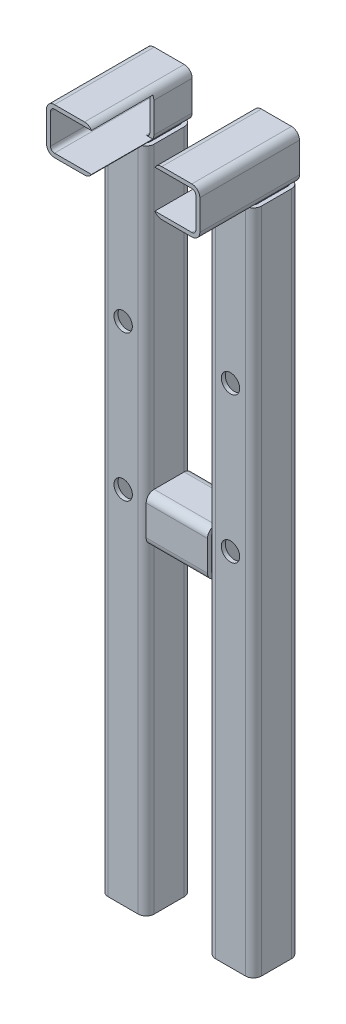
from build123d import *

# Parameters (mm, degrees)
RURA_START                              = -15
RURA_KWADRATOWA_30_X_30_X_2_6_1_DEPTH   = 65
RURA_START_2                            = -225
RURA_KWADRATOWA_30_X_30_X_2_6_1_2_DEPTH = 435
RURA_START_3                            = -20
RURA_KWADRATOWA_30_X_30_X_2_6_1_3_DEPTH = 40
WYTNIJ_WYCI_GNI_CIE1_START              = -5.2
SZKIC3_W                                = 40
SZKIC3_H                                = 24.8
WYTNIJ_WYCI_GNI_CIE1_DEPTH              = 50.4
SZKIC4_R                                = 6
WYTNIJ_WYCI_GNI_CIE2_DEPTH              = 254.623737059


# Read off the part's stored shape, not the designer's step: Rura kwadratowa 30 X 30 X 2.6(1)
with BuildPart() as part:
    # Rura kwadratowa 30 X 30 X 2.6(1) outline → Rura kwadratowa 30 X 30 X 2.6(1) (new body)
    # profile 1 of 2: a face of its own
    with BuildSketch(Plane.XY.offset(RURA_START)):
        with BuildLine():
            Line((-44.8, 210), (-25.2, 210))
            ThreePointArc((-25.2, 210), (-21.523044738, 211.523044738), (-20, 215.2))
            Line((-20, 215.2), (-20, 234.8))
            ThreePointArc((-20, 234.8), (-21.523044738, 238.476955262), (-25.2, 240))
            Line((-25.2, 240), (-44.8, 240))
            ThreePointArc((-44.8, 240), (-48.476955262, 238.476955262), (-50, 234.8))
            Line((-50, 234.8), (-50, 215.2))
            ThreePointArc((-50, 215.2), (-48.476955262, 211.523044738), (-44.8, 210))
        make_face()
        with BuildLine():
            ThreePointArc((-44.8, 212.6), (-46.638477631, 213.361522369), (-47.4, 215.2))
            Line((-47.4, 215.2), (-47.4, 234.8))
            ThreePointArc((-47.4, 234.8), (-46.638477631, 236.638477631), (-44.8, 237.4))
            Line((-44.8, 237.4), (-25.2, 237.4))
            ThreePointArc((-25.2, 237.4), (-23.361522369, 236.638477631), (-22.6, 234.8))
            Line((-22.6, 234.8), (-22.6, 215.2))
            ThreePointArc((-22.6, 215.2), (-23.361522369, 213.361522369), (-25.2, 212.6))
            Line((-25.2, 212.6), (-44.8, 212.6))
        make_face(mode=Mode.SUBTRACT)
    # profile 2 of 2: a face of its own
    with BuildSketch(Plane.XY.offset(RURA_START)):
        with BuildLine():
            ThreePointArc((50, 234.8), (48.476955262, 238.476955262), (44.8, 240))
            Line((44.8, 240), (25.2, 240))
            ThreePointArc((25.2, 240), (21.523044738, 238.476955262), (20, 234.8))
            Line((20, 234.8), (20, 215.2))
            ThreePointArc((20, 215.2), (21.523044738, 211.523044738), (25.2, 210))
            Line((25.2, 210), (44.8, 210))
            ThreePointArc((44.8, 210), (48.476955262, 211.523044738), (50, 215.2))
            Line((50, 215.2), (50, 234.8))
        make_face()
        with BuildLine():
            Line((22.6, 215.2), (22.6, 234.8))
            ThreePointArc((22.6, 234.8), (23.361522369, 236.638477631), (25.2, 237.4))
            Line((25.2, 237.4), (44.8, 237.4))
            ThreePointArc((44.8, 237.4), (46.638477631, 236.638477631), (47.4, 234.8))
            Line((47.4, 234.8), (47.4, 215.2))
            ThreePointArc((47.4, 215.2), (46.638477631, 213.361522369), (44.8, 212.6))
            Line((44.8, 212.6), (25.2, 212.6))
            ThreePointArc((25.2, 212.6), (23.361522369, 213.361522369), (22.6, 215.2))
        make_face(mode=Mode.SUBTRACT)
    extrude(amount=RURA_KWADRATOWA_30_X_30_X_2_6_1_DEPTH)

    # Szkic3 → Wytnij-wyciągnięcie1 (cut)
    with BuildSketch(Plane.ZY.offset(-20).offset(WYTNIJ_WYCI_GNI_CIE1_START)):
        with Locations((30, 225)):
            Rectangle(SZKIC3_W, SZKIC3_H)
    extrude(amount=WYTNIJ_WYCI_GNI_CIE1_DEPTH, mode=Mode.SUBTRACT)


with BuildPart() as body_2:
    # Rura kwadratowa 30 X 30 X 2.6_1 2 outlin → Rura kwadratowa 30 X 30 X 2.6_1 2 (new body)
    # profile 1 of 2: a face of its own
    with BuildSketch(Plane(origin=(0, 0, 0), x_dir=(1, 0, 0), z_dir=(0, 1, 0)).offset(RURA_START_2)):
        with BuildLine():
            Line((-20, -9.8), (-20, 9.8))
            ThreePointArc((-20, 9.8), (-21.523044738, 13.476955262), (-25.2, 15))
            Line((-25.2, 15), (-44.8, 15))
            ThreePointArc((-44.8, 15), (-48.476955262, 13.476955262), (-50, 9.8))
            Line((-50, 9.8), (-50, -9.8))
            ThreePointArc((-50, -9.8), (-48.476955262, -13.476955262), (-44.8, -15))
            Line((-44.8, -15), (-25.2, -15))
            ThreePointArc((-25.2, -15), (-21.523044738, -13.476955262), (-20, -9.8))
        make_face()
        with BuildLine():
            ThreePointArc((-44.8, -12.4), (-46.638477631, -11.638477631), (-47.4, -9.8))
            Line((-47.4, -9.8), (-47.4, 9.8))
            ThreePointArc((-47.4, 9.8), (-46.638477631, 11.638477631), (-44.8, 12.4))
            Line((-44.8, 12.4), (-25.2, 12.4))
            ThreePointArc((-25.2, 12.4), (-23.361522369, 11.638477631), (-22.6, 9.8))
            Line((-22.6, 9.8), (-22.6, -9.8))
            ThreePointArc((-22.6, -9.8), (-23.361522369, -11.638477631), (-25.2, -12.4))
            Line((-25.2, -12.4), (-44.8, -12.4))
        make_face(mode=Mode.SUBTRACT)
    # profile 2 of 2: a face of its own
    with BuildSketch(Plane(origin=(0, 0, 0), x_dir=(1, 0, 0), z_dir=(0, 1, 0)).offset(RURA_START_2)):
        with BuildLine():
            ThreePointArc((50, 9.8), (48.476955262, 13.476955262), (44.8, 15))
            Line((44.8, 15), (25.2, 15))
            ThreePointArc((25.2, 15), (21.523044738, 13.476955262), (20, 9.8))
            Line((20, 9.8), (20, -9.8))
            ThreePointArc((20, -9.8), (21.523044738, -13.476955262), (25.2, -15))
            Line((25.2, -15), (44.8, -15))
            ThreePointArc((44.8, -15), (48.476955262, -13.476955262), (50, -9.8))
            Line((50, -9.8), (50, 9.8))
        make_face()
        with BuildLine():
            Line((22.6, -9.8), (22.6, 9.8))
            ThreePointArc((22.6, 9.8), (23.361522369, 11.638477631), (25.2, 12.4))
            Line((25.2, 12.4), (44.8, 12.4))
            ThreePointArc((44.8, 12.4), (46.638477631, 11.638477631), (47.4, 9.8))
            Line((47.4, 9.8), (47.4, -9.8))
            ThreePointArc((47.4, -9.8), (46.638477631, -11.638477631), (44.8, -12.4))
            Line((44.8, -12.4), (25.2, -12.4))
            ThreePointArc((25.2, -12.4), (23.361522369, -11.638477631), (22.6, -9.8))
        make_face(mode=Mode.SUBTRACT)
    extrude(amount=RURA_KWADRATOWA_30_X_30_X_2_6_1_2_DEPTH)

    # Szkic4 → Wytnij-wyciągnięcie2 (cut, through all)
    with BuildSketch(Plane(origin=(0, 0, -15), x_dir=(-1, 0, 0), z_dir=(0, 0, -1))):
        with Locations(Location((35, 105, 0), (0, 0, 90))):
            Circle(SZKIC4_R)
        with Locations(Location((35, 10, 0), (0, 0, 90))):
            Circle(SZKIC4_R)
        with Locations((-35, 105)):
            Circle(SZKIC4_R)
        with Locations((-35, 10)):
            Circle(SZKIC4_R)
    extrude(amount=-WYTNIJ_WYCI_GNI_CIE2_DEPTH, mode=Mode.SUBTRACT)


with BuildPart() as body_3:
    # Rura kwadratowa 30 X 30 X 2.6_1 3 outlin → Rura kwadratowa 30 X 30 X 2.6_1 3 (new body)
    with BuildSketch(Plane.YZ.offset(RURA_START_3)):
        with BuildLine():
            Line((-9.8, -15), (9.8, -15))
            ThreePointArc((9.8, -15), (13.476955262, -13.476955262), (15, -9.8))
            Line((15, -9.8), (15, 9.8))
            ThreePointArc((15, 9.8), (13.476955262, 13.476955262), (9.8, 15))
            Line((9.8, 15), (-9.8, 15))
            ThreePointArc((-9.8, 15), (-13.476955262, 13.476955262), (-15, 9.8))
            Line((-15, 9.8), (-15, -9.8))
            ThreePointArc((-15, -9.8), (-13.476955262, -13.476955262), (-9.8, -15))
        make_face()
        with BuildLine():
            ThreePointArc((-12.4, 9.8), (-11.638477631, 11.638477631), (-9.8, 12.4))
            Line((-9.8, 12.4), (9.8, 12.4))
            ThreePointArc((9.8, 12.4), (11.638477631, 11.638477631), (12.4, 9.8))
            Line((12.4, 9.8), (12.4, -9.8))
            ThreePointArc((12.4, -9.8), (11.638477631, -11.638477631), (9.8, -12.4))
            Line((9.8, -12.4), (-9.8, -12.4))
            ThreePointArc((-9.8, -12.4), (-11.638477631, -11.638477631), (-12.4, -9.8))
            Line((-12.4, -9.8), (-12.4, 9.8))
        make_face(mode=Mode.SUBTRACT)
    extrude(amount=RURA_KWADRATOWA_30_X_30_X_2_6_1_3_DEPTH)


solid = Compound([part.part, body_2.part, body_3.part])
